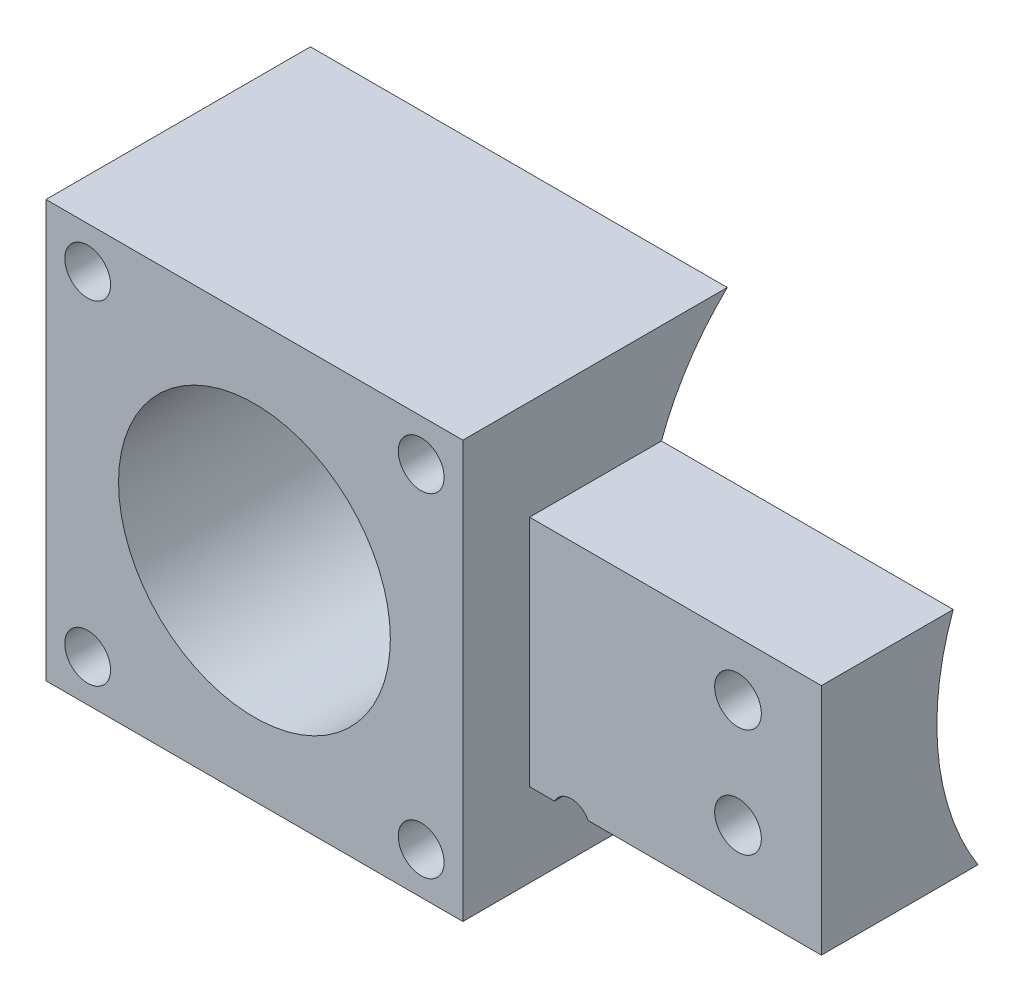
from build123d import *
from build123d.topology import SkipClean

# Parameters (mm, degrees)
SKETCH1_W               = 50
SKETCH1_H               = 50
SKETCH1_R               = 16.3
SKETCH1_R_2             = 2.75
BOSS_EXTRUDE1_DEPTH     = 53.6
CUT_EXTRUDE1_DEPTH      = 66.015075175
CUT_EXTRUDE1_DEPTH_BACK = 66.015075175
SKETCH2_R               = 31.75
BOSS_EXTRUDE3_START     = 35
BOSS_EXTRUDE3_DEPTH     = 35
SKETCH12_W              = 60
SKETCH12_H              = 66
CUT_EXTRUDE7_DEPTH      = 8
CUT_EXTRUDE5_DEPTH      = 85.864362462
CUT_EXTRUDE5_DEPTH_BACK = 85.864362462
SKETCH9_R               = 2.25
CUT_EXTRUDE6_DEPTH      = 72.860361661
CUT_EXTRUDE6_DEPTH_BACK = 10
SKETCH10_R              = 2.8


with BuildPart() as part:
    # Sketch1 → Boss-Extrude1 (new body)
    with BuildSketch(Plane.XY):
        with Locations((0, -2)):
            Rectangle(SKETCH1_W, SKETCH1_H)
        with Locations((0, -2)):
            Circle(SKETCH1_R, mode=Mode.SUBTRACT)
        with Locations((-20, 18)):
            Circle(SKETCH1_R_2, mode=Mode.SUBTRACT)
        with Locations((20, 18)):
            Circle(SKETCH1_R_2, mode=Mode.SUBTRACT)
        with Locations((20, -22)):
            Circle(SKETCH1_R_2, mode=Mode.SUBTRACT)
        with Locations((-20, -22)):
            Circle(SKETCH1_R_2, mode=Mode.SUBTRACT)
    extrude(amount=BOSS_EXTRUDE1_DEPTH)

    # Sketch2 → Cut-Extrude1 (cut, two sides: drawn at the far end of the back side and taken through both)
    with BuildSketch(Plane(origin=(0, 0, 0), x_dir=(0, 0, -1), z_dir=(1, 0, 0)).offset(-CUT_EXTRUDE1_DEPTH_BACK)):
        Circle(SKETCH2_R)
    extrude(amount=CUT_EXTRUDE1_DEPTH + CUT_EXTRUDE1_DEPTH_BACK, mode=Mode.SUBTRACT)

    # Sketch4 → Boss-Extrude3 (add)
    with SkipClean():  # the faces are left unmerged after this step: merging them gives an invalid solid
        with BuildSketch(Plane(origin=(25, 0, 0), x_dir=(0, 0, -1), z_dir=(1, 0, 0)).offset(BOSS_EXTRUDE3_START)):
            with BuildLine():
                Line((-53.6, 11), (-53.6, -17))
                Line((-53.6, -17), (-26.815340759, -17))
                ThreePointArc((-26.815340759, -17), (-31.573087709, -3.347033393), (-29.783594477, 11))
                Line((-29.783594477, 11), (-53.6, 11))
            make_face()
        extrude(amount=-BOSS_EXTRUDE3_DEPTH)

    # Sketch12 → Cut-Extrude7 (cut)
    with SkipClean():  # the faces are left unmerged after this step: merging them gives an invalid solid
        with BuildSketch(Plane.XY.offset(53.6)):
            with Locations((55, -2)):
                Rectangle(SKETCH12_W, SKETCH12_H)
        extrude(amount=-CUT_EXTRUDE7_DEPTH, mode=Mode.SUBTRACT)

    # Sketch9 → Cut-Extrude5 (cut, two sides: drawn at the far end of the back side and taken through both)
    with SkipClean():  # the faces are left unmerged after this step: merging them gives an invalid solid
        with BuildSketch(Plane.XY.offset(-CUT_EXTRUDE5_DEPTH_BACK)):
            with Locations((30, 22)):
                Circle(SKETCH9_R)
            with Locations((70, 22)):
                Circle(SKETCH9_R)
            with Locations((70, -18)):
                Circle(SKETCH9_R)
            with Locations((30, -18)):
                Circle(SKETCH9_R)
        extrude(amount=CUT_EXTRUDE5_DEPTH + CUT_EXTRUDE5_DEPTH_BACK, mode=Mode.SUBTRACT)

    # Sketch10 → Cut-Extrude6 (cut, two sides: drawn at the far end of the back side and taken through both)
    with SkipClean():  # the faces are left unmerged after this step: merging them gives an invalid solid
        with BuildSketch(Plane.XY.offset(45.6).offset(-CUT_EXTRUDE6_DEPTH_BACK)):
            with Locations((50, 4.5)):
                Circle(SKETCH10_R)
            with Locations((50, -8.5)):
                Circle(SKETCH10_R)
        extrude(amount=CUT_EXTRUDE6_DEPTH + CUT_EXTRUDE6_DEPTH_BACK, mode=Mode.SUBTRACT)


solid = part.part
